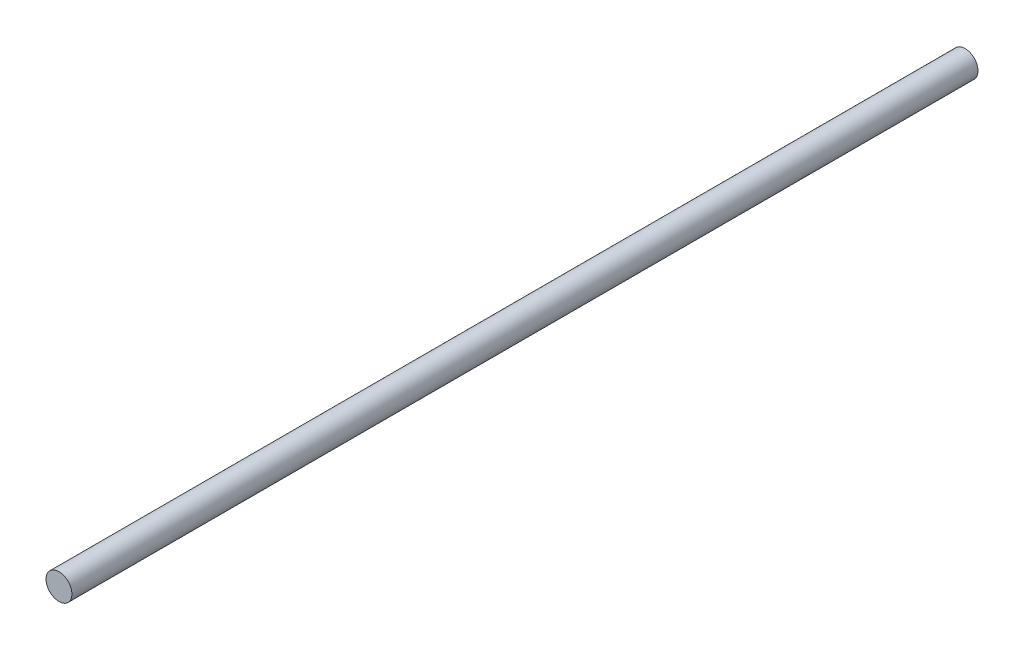
from build123d import *

# Parameters (mm, degrees)
SKETCH1_W = 2.54
SKETCH1_H = 177.8


with BuildPart() as part:
    # Sketch1 → Revolve-Thin1 (revolve)
    with BuildSketch(Plane(origin=(0, 0, 0), x_dir=(1, 0, 0), z_dir=(0, 1, 0))):
        with Locations((-1.743791677, 2.343903032)):
            Rectangle(SKETCH1_W, SKETCH1_H)
    revolve(axis=Axis((-3.013791677, 0, -91.243903032), (0, 0, 1)))


solid = part.part
